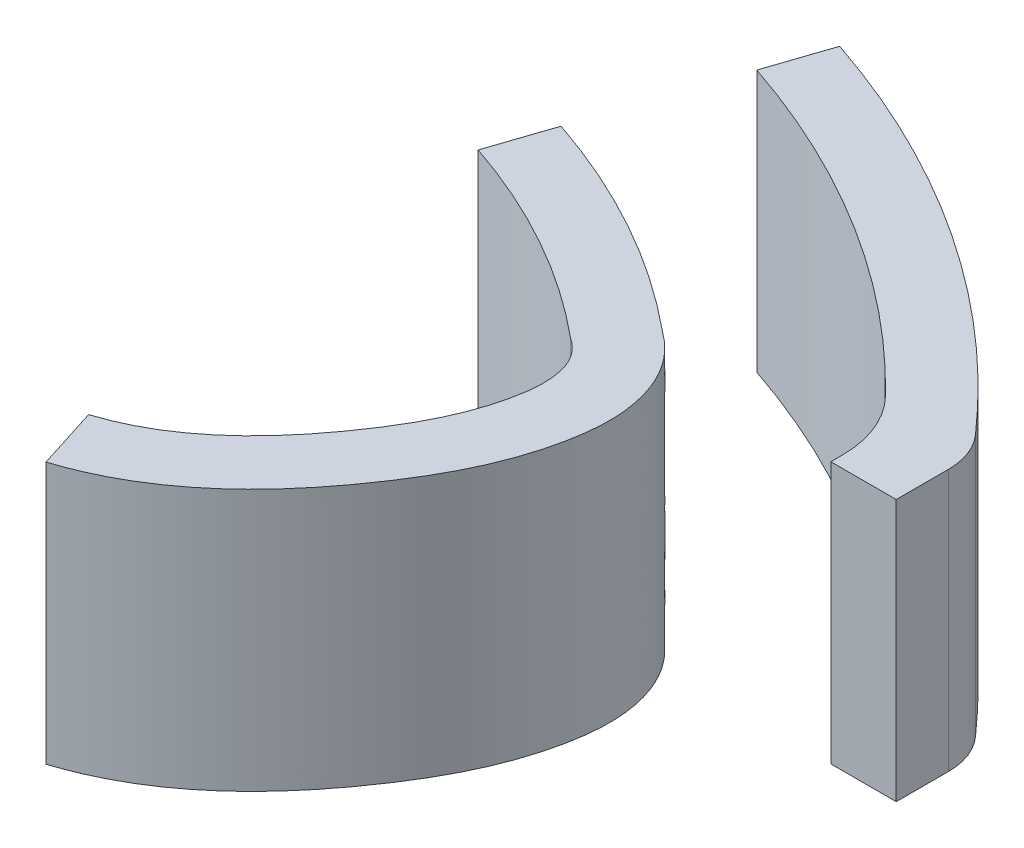
from build123d import *

# Parameters (mm, degrees)
BOSS_EXTRUDE1_DEPTH = 25.4
FILLET1_R           = 10
BOSS_EXTRUDE4_START = -25.4
BOSS_EXTRUDE4_DEPTH = 25.4


# Read off the part's stored shape, not the designer's step: Boss-Extrude4
with BuildPart() as part:
    # Sketch2 → Boss-Extrude1 (new body)
    with BuildSketch(Plane(origin=(0, 0, 0), x_dir=(1, 0, 0), z_dir=(0, 1, 0))):
        with BuildLine():
            Line((26.990684498, 80.247524419), (29.015025684, 86.266207228))
            ThreePointArc((29.015025684, 86.266207228), (50.353700038, 75.817116257), (68.260852948, 60.201214106))
            ThreePointArc((68.260852948, 60.201214106), (69.438254348, 58.246136107), (69.84838065, 56.001052489))
            Line((69.84838065, 56.001052489), (69.84838065, 50.921052489))
            Line((69.84838065, 50.921052489), (63.49838065, 50.921052489))
            Line((63.49838065, 50.921052489), (63.49838065, 56.001052489))
            ThreePointArc((63.49838065, 56.001052489), (46.840586867, 70.527453144), (26.990684498, 80.247524419))
        make_face()
    extrude(amount=BOSS_EXTRUDE1_DEPTH)

    # Fillet1
    fillet1_edges = [part.edges().sort_by_distance(p)[0] for p in [
        (63.49838065, 12.7, -56.001052489),
    ]]
    fillet(fillet1_edges, radius=FILLET1_R)


with BuildPart() as body_2:
    # Boss-Extrude4 outline → Boss-Extrude4 (new body)
    with BuildSketch(Plane.XZ.offset(BOSS_EXTRUDE4_START)):
        with BuildLine():
            Line((25.443194989, -12.813304883), (23.525014075, -18.866657837))
            add(Edge.make_bspline(
                [(23.525014075, -18.866657837), (26.114575337, -19.687235626), (31.775394583, -22.853586916), (38.317852456, -30.637589066), (43.142544067, -39.612852868), (43.312489198, -46.804499087), (40.524158317, -48.647526327)],
                knots=[0, 0, 0, 0, 0.205148784, 0.501586038, 0.771461063, 1, 1, 1, 1], degree=3))
            ThreePointArc((40.524158317, -48.647526327), (30.881518582, -55.273149314), (20.184434996, -60.011480642))
            Line((20.184434996, -60.011480642), (22.208776183, -66.030163452))
            ThreePointArc((22.208776183, -66.030163452), (33.849439104, -60.888649988), (44.360626436, -53.715426529))
            add(Edge.make_bspline(
                [(44.360626436, -53.715426529), (45.015216296, -53.250169824), (46.343641563, -52.092024645), (47.875354125, -49.947427349), (48.838279291, -47.569566152), (49.40857056, -44.540276682), (49.270972893, -41.891353114), (48.869817551, -39.602052244), (48.36616574, -37.521826688), (47.535128231, -35.035489663), (46.300392638, -32.303771245), (44.89812363, -29.783016532), (43.413252329, -27.47460777), (41.834458355, -25.246492838), (39.507630167, -22.312259754), (36.178518616, -18.835694792), (32.146020616, -15.831975993), (28.473476707, -13.910036954), (26.459130099, -13.13523271), (25.443194989, -12.813304883)],
                knots=[0.004512861, 0.004512861, 0.004512861, 0.004512861, 0.03125, 0.0625, 0.09375, 0.125, 0.1875, 0.21875, 0.25, 0.3125, 0.375, 0.4375, 0.5, 0.5625, 0.625, 0.75, 0.875, 0.9375, 1, 1, 1, 1], degree=3))
        make_face()
    extrude(amount=BOSS_EXTRUDE4_DEPTH)


solid = Compound([part.part, body_2.part])
